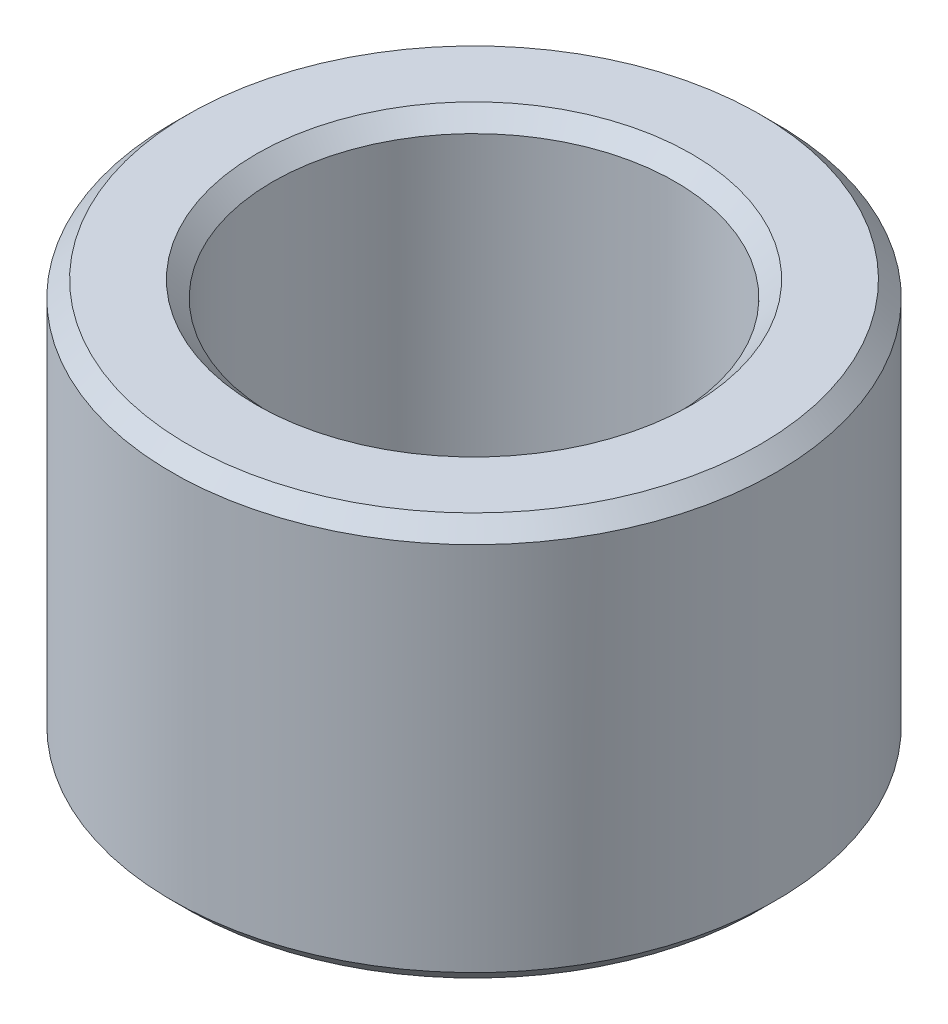
from build123d import *

# Parameters (mm, degrees)
SKETCH1_W     = 1.5875
SKETCH1_H     = 6.35
CHAMFER1_SIZE = 0.254


with BuildPart() as part:
    # Sketch1 → Revolve1 (revolve)
    with BuildSketch(Plane.XY):
        with Locations((3.96875, 0)):
            Rectangle(SKETCH1_W, SKETCH1_H)
    revolve(axis=Axis((0, 2.822643956, 0), (0, -1, 0)))

    # Chamfer1
    chamfer1_edges = [part.edges().sort_by_distance(p)[0] for p in [
        (-3.175, -3.175, 0),
        (-4.7625, -3.175, 0),
        (-4.7625, 3.175, 0),
        (-3.175, 3.175, 0),
    ]]
    chamfer(chamfer1_edges, length=CHAMFER1_SIZE)


solid = part.part
